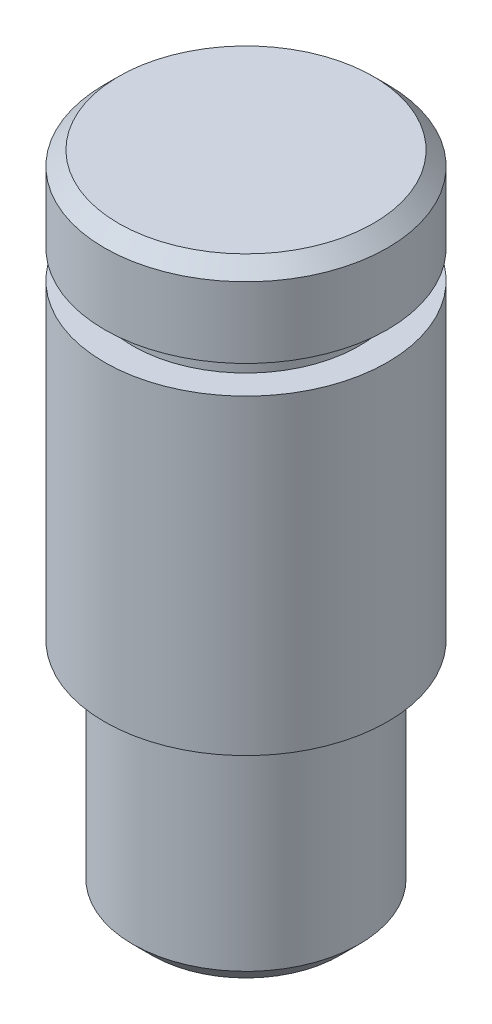
from build123d import *

# Parameters (mm, degrees)
SKETCH1_R           = 5
BOSS_EXTRUDE1_DEPTH = 23
CHAMFER1_SIZE       = 0.5
CUT_EXTRUDE1_START  = -3
SKETCH2_R           = 6
SKETCH2_R_2         = 4
CUT_EXTRUDE1_DEPTH  = 1


# Read off the part's stored shape, not the designer's step: M8 Machine Threads Stud1
with BuildPart() as part:
    # Sketch1 → Boss-Extrude1 (new body)
    with BuildSketch(Plane(origin=(0, 0, 0), x_dir=(1, 0, 0), z_dir=(0, 1, 0))):
        with Locations(Location((0, 0, 0), (0, 0, 270))):
            Circle(SKETCH1_R)
    extrude(amount=BOSS_EXTRUDE1_DEPTH)

    # Chamfer1
    chamfer1_edges = [part.edges().sort_by_distance(p)[0] for p in [
        (0, 23, -5),
    ]]
    chamfer(chamfer1_edges, length=CHAMFER1_SIZE)

    # Sketch2 → Cut-Extrude1 (cut)
    with BuildSketch(Plane(origin=(0, 23, 0), x_dir=(1, 0, 0), z_dir=(0, 1, 0)).offset(CUT_EXTRUDE1_START)):
        Circle(SKETCH2_R)
        with Locations(Location((0, 0, 0), (0, 0, 270))):
            Circle(SKETCH2_R_2, mode=Mode.SUBTRACT)
    extrude(amount=-CUT_EXTRUDE1_DEPTH, mode=Mode.SUBTRACT)

    # M8 Machine Threads Stud1 outline → M8 Machine Threads Stud1 (revolve, cut)
    with BuildSketch(Plane.XY):
        Polygon((3.3095, 0), (5, 0), (5, 8), (4, 8), (4, 0.6905), align=None)
    revolve(axis=Axis((0, 0, 0), (0, 1, 0)), mode=Mode.SUBTRACT)


solid = part.part
